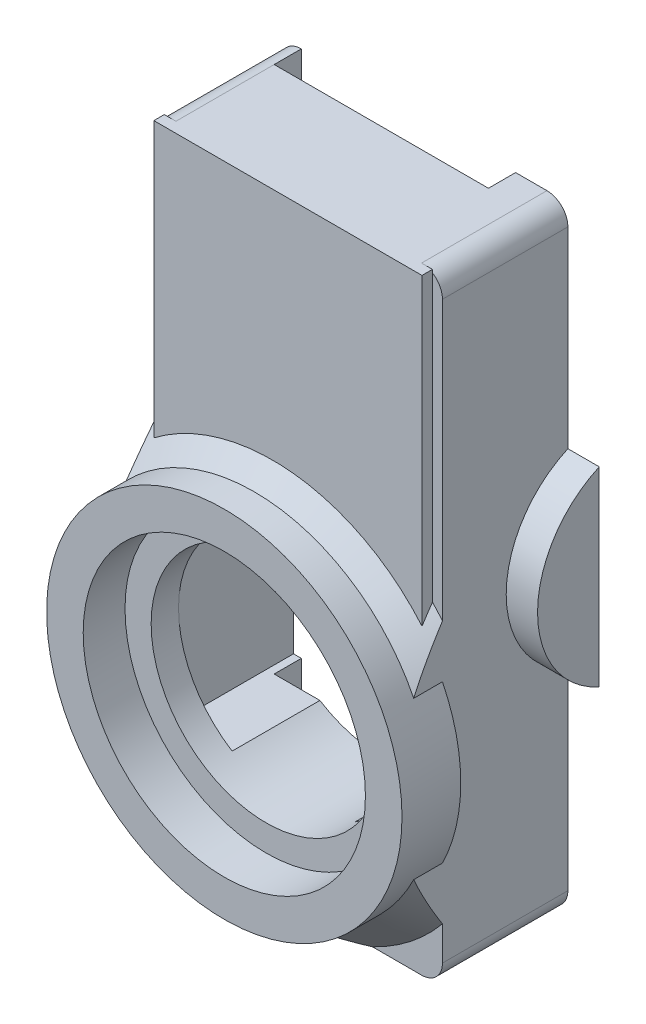
from build123d import *

# Parameters (mm, degrees)
BOSS_EXTRUDE1_DEPTH      = 11
CUT_EXTRUDE1_DEPTH       = 62.923844357
CUT_EXTRUDE1_DEPTH_BACK  = 62.923844357
SKETCH2_W                = 20.5
SKETCH2_H                = 2.6
BOSS_EXTRUDE3_START      = -8.4
BOSS_EXTRUDE3_DEPTH      = 9.4
SKETCH4_R                = 17
SKETCH4_R_2              = 10
BOSS_EXTRUDE2_DEPTH      = 5.62
SKETCH5_R                = 13.5
CUT_EXTRUDE2_DEPTH       = 4
CUT_EXTRUDE3_DEPTH       = 37.67089309
CUT_EXTRUDE3_DEPTH_BACK  = 37.67089309
SKETCH6_R                = 10.5
BOSS_EXTRUDE4_START      = 1.12
SKETCH18_R               = 17
BOSS_EXTRUDE4_DEPTH      = 1.12
CHAMFER3_SIZE            = 2.75
BOSS_EXTRUDE7_START      = 1
BOSS_EXTRUDE7_DEPTH      = 1
CUT_EXTRUDE17_START      = 12
SKETCH28_W               = 22
SKETCH28_H               = 42
CUT_EXTRUDE17_DEPTH      = 11
CUT_EXTRUDE18_DEPTH      = 37.488140539
CUT_EXTRUDE18_DEPTH_BACK = 37.488140539
SKETCH29_R               = 11
SKETCH31_R               = 1.9
CUT_EXTRUDE19_DEPTH      = 7
BOSS_EXTRUDE8_DEPTH      = 3


with BuildPart() as part:
    # Sketch1 → Boss-Extrude1 (new body)
    with BuildSketch(Plane.XY):
        with BuildLine():
            ThreePointArc((15.25, 27.5), (14.664213562, 28.914213562), (13.25, 29.5))
            Line((13.25, 29.5), (-10.25, 29.5))
            ThreePointArc((-10.25, 29.5), (-11.664213562, 28.914213562), (-12.25, 27.5))
            Line((-12.25, 27.5), (-12.25, 0.346410162))
            Line((-12.25, 0.346410162), (-12.25, 0))
            Line((-12.25, 0), (-12.25, -0.346410162))
            Line((-12.25, -0.346410162), (-12.25, -27.5))
            ThreePointArc((-12.25, -27.5), (-11.664213562, -28.914213562), (-10.25, -29.5))
            Line((-10.25, -29.5), (13.25, -29.5))
            ThreePointArc((13.25, -29.5), (14.664213562, -28.914213562), (15.25, -27.5))
            Line((15.25, -27.5), (15.25, -9.120855223))
            Line((15.25, -9.120855223), (15.25, 9.120855223))
            Line((15.25, 9.120855223), (15.25, 27.5))
        make_face()
        with BuildLine():
            Line((7, 22.5), (10.25, 22.5))
            Line((10.25, 22.5), (10.25, -22.5))
            Line((10.25, -22.5), (7, -22.5))
            Line((7, -22.5), (7, -24.7))
            ThreePointArc((7, -24.7), (5, -26.7), (3, -24.7))
            Line((3, -24.7), (3, -22.5))
            Line((3, -22.5), (-3, -22.5))
            Line((-3, -22.5), (-3, -24.7))
            ThreePointArc((-3, -24.7), (-5, -26.7), (-7, -24.7))
            Line((-7, -24.7), (-7, -22.5))
            Line((-7, -22.5), (-10.25, -22.5))
            Line((-10.25, -22.5), (-10.25, 22.5))
            Line((-10.25, 22.5), (-7, 22.5))
            Line((-7, 22.5), (-7, 24.7))
            ThreePointArc((-7, 24.7), (-5, 26.7), (-3, 24.7))
            Line((-3, 24.7), (-3, 22.5))
            Line((-3, 22.5), (3, 22.5))
            Line((3, 22.5), (3, 24.7))
            ThreePointArc((3, 24.7), (5, 26.7), (7, 24.7))
            Line((7, 24.7), (7, 22.5))
        make_face(mode=Mode.SUBTRACT)
    extrude(amount=BOSS_EXTRUDE1_DEPTH)

    # Sketch2 → Cut-Extrude1 (cut, two sides: drawn at the far end of the back side and taken through both)
    with BuildSketch(Plane(origin=(0, 29.5, 0), x_dir=(1, 0, 0), z_dir=(0, 1, 0)).offset(-CUT_EXTRUDE1_DEPTH_BACK)):
        with Locations((0, -1.3)):
            Rectangle(SKETCH2_W, SKETCH2_H)
    extrude(amount=CUT_EXTRUDE1_DEPTH + CUT_EXTRUDE1_DEPTH_BACK, mode=Mode.SUBTRACT)

    # Sketch3 → Boss-Extrude3 (add)
    with BuildSketch(Plane.XY.offset(11).offset(BOSS_EXTRUDE3_START)):
        with BuildLine():
            Line((-10.25, -29.5), (13.25, -29.5))
            ThreePointArc((13.25, -29.5), (14.664213562, -28.914213562), (15.25, -27.5))
            Line((15.25, -27.5), (15.25, 27.5))
            ThreePointArc((15.25, 27.5), (14.664213562, 28.914213562), (13.25, 29.5))
            Line((13.25, 29.5), (-10.25, 29.5))
            ThreePointArc((-10.25, 29.5), (-11.664213562, 28.914213562), (-12.25, 27.5))
            Line((-12.25, 27.5), (-12.25, -27.5))
            ThreePointArc((-12.25, -27.5), (-11.664213562, -28.914213562), (-10.25, -29.5))
        make_face()
    extrude(amount=BOSS_EXTRUDE3_DEPTH)

    # Sketch4 → Boss-Extrude2 (add)
    with BuildSketch(Plane.XY.offset(17.62)):
        with Locations((0, -11.7)):
            Circle(SKETCH4_R)
        with Locations((0, -11.7)):
            Circle(SKETCH4_R_2, mode=Mode.SUBTRACT)
    extrude(amount=-BOSS_EXTRUDE2_DEPTH)

    # Sketch5 → Cut-Extrude2 (cut)
    with BuildSketch(Plane.XY.offset(17.62)):
        with Locations((0, -11.7)):
            Circle(SKETCH5_R)
    extrude(amount=-CUT_EXTRUDE2_DEPTH, mode=Mode.SUBTRACT)

    # Sketch6 → Cut-Extrude3 (cut, two sides: drawn at the far end of the back side and taken through both)
    with BuildSketch(Plane.XY.offset(13.62).offset(-CUT_EXTRUDE3_DEPTH_BACK)):
        with Locations((0, -11.7)):
            Circle(SKETCH6_R)
    extrude(amount=CUT_EXTRUDE3_DEPTH + CUT_EXTRUDE3_DEPTH_BACK, mode=Mode.SUBTRACT)

    # Sketch18 → Boss-Extrude4 (add)
    with BuildSketch(Plane.XY.offset(12).offset(BOSS_EXTRUDE4_START)):
        with Locations((0, -11.7)):
            Circle(SKETCH18_R)
    extrude(amount=-BOSS_EXTRUDE4_DEPTH)

    # Chamfer3
    # the kernel refuses this chamfer: 2.75 mm, written as the material it adds along each edge
    with BuildSketch(Plane(origin=(0, -11.7, 12), x_dir=(0.99914018616096, 0.041459478991448445, 0), z_dir=(0.041459478991448445, -0.99914018616096, 0))) as chamfer3_piece_1_section:
        Polygon((17, CHAMFER3_SIZE), (17 + CHAMFER3_SIZE, 0), (17, 0), align=None)
    chamfer3_piece_1 = revolve(axis=Axis((0, -11.7, 12), (0, 0, 1)), revolution_arc=157.576683104, mode=Mode.PRIVATE)
    chamfer3_piece_1 = split(chamfer3_piece_1, bisect_by=Plane(origin=(15.25, 6.422467161, 13.340102963), z_dir=(-1, 0, 0)), keep=Keep.TOP, mode=Mode.PRIVATE)
    chamfer3_piece_1 = split(chamfer3_piece_1, bisect_by=Plane(origin=(-12.25, 6.422467161, 13.340102963), z_dir=(1, 0, 0)), keep=Keep.TOP, mode=Mode.PRIVATE)
    add(chamfer3_piece_1)
    with BuildSketch(Plane(origin=(0, -11.7, 12), x_dir=(-0.9394106509692863, -0.3427938576542199, 0), z_dir=(-0.3427938576542199, 0.9394106509692863, 0))) as chamfer3_piece_2_section:
        Polygon((17, CHAMFER3_SIZE), (17 + CHAMFER3_SIZE, 0), (17, 0), align=None)
    chamfer3_piece_2 = revolve(axis=Axis((0, -11.7, 12), (0, 0, 1)), revolution_arc=157.576683104, mode=Mode.PRIVATE)
    chamfer3_piece_2 = split(chamfer3_piece_2, bisect_by=Plane(origin=(15.25, -27.115392877, 14.25853692), z_dir=(-1, 0, 0)), keep=Keep.TOP, mode=Mode.PRIVATE)
    chamfer3_piece_2 = split(chamfer3_piece_2, bisect_by=Plane(origin=(-12.25, -27.115392877, 14.25853692), z_dir=(1, 0, 0)), keep=Keep.TOP, mode=Mode.PRIVATE)
    chamfer3_piece_2 = split(chamfer3_piece_2, bisect_by=Plane(origin=(-8.124246578, -29.5, 14.25853692), z_dir=(0, 1, 0)), keep=Keep.TOP, mode=Mode.PRIVATE)
    add(chamfer3_piece_2)

    # Sketch19 → Boss-Extrude7 (add)
    with BuildSketch(Plane.XY.offset(12).offset(BOSS_EXTRUDE7_START)):
        with BuildLine():
            Line((-11.360440511, 29.5), (-11.360440511, 0.946754184))
            ThreePointArc((-11.360440511, 0.946754184), (2.262558078, 5.148763484), (14.294383554, -2.498337172))
            Line((14.294383554, -2.498337172), (14.294383554, 29.5))
            Line((14.294383554, 29.5), (-11.360440511, 29.5))
        make_face()
    extrude(amount=-BOSS_EXTRUDE7_DEPTH)

    # Sketch28 → Cut-Extrude17 (cut)
    with BuildSketch(Plane(origin=(0, 0, 12), x_dir=(-1, 0, 0), z_dir=(0, 0, -1)).offset(CUT_EXTRUDE17_START)):
        Rectangle(SKETCH28_W, SKETCH28_H)
    extrude(amount=-CUT_EXTRUDE17_DEPTH, mode=Mode.SUBTRACT)

    # Sketch29 → Cut-Extrude18 (cut, two sides: drawn at the far end of the back side and taken through both)
    with BuildSketch(Plane.XY.offset(13.12).offset(-CUT_EXTRUDE18_DEPTH_BACK)):
        with Locations((0, -11.7)):
            Circle(SKETCH29_R)
    extrude(amount=CUT_EXTRUDE18_DEPTH + CUT_EXTRUDE18_DEPTH_BACK, mode=Mode.SUBTRACT)

    # Sketch31 → Cut-Extrude19 (cut)
    with BuildSketch(Plane(origin=(0, 0, 2.6), x_dir=(-1, 0, 0), z_dir=(0, 0, -1))):
        with Locations((5, 24.7)):
            Circle(SKETCH31_R)
        with Locations((-5, 24.7)):
            Circle(SKETCH31_R)
        with Locations((-5, -24.7)):
            Circle(SKETCH31_R)
        with Locations((5, -24.7)):
            Circle(SKETCH31_R)
    extrude(amount=-CUT_EXTRUDE19_DEPTH, mode=Mode.SUBTRACT)

    # Sketch35 → Boss-Extrude8 (add)
    with BuildSketch(Plane(origin=(15.25, 0, 0), x_dir=(0, 0, -1), z_dir=(1, 0, 0))):
        with BuildLine():
            Line((0, -9.120855223), (0, 9.120855223))
            ThreePointArc((0, 9.120855223), (-5.9, 0), (0, -9.120855223))
        make_face()
    extrude(amount=BOSS_EXTRUDE8_DEPTH)


solid = part.part
